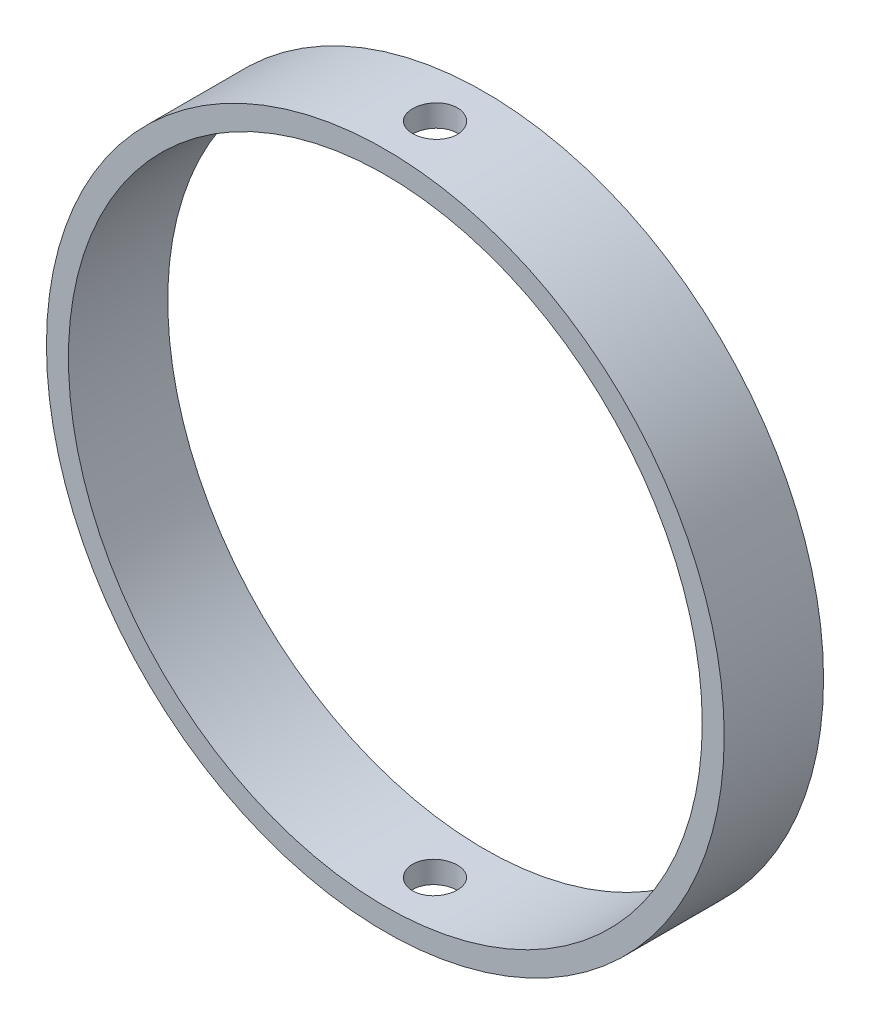
from build123d import *

# Parameters (mm, degrees)
SKETCH1_R           = 34.11
SKETCH1_R_2         = 31.9
BOSS_EXTRUDE1_DEPTH = 10
SKETCH2_R           = 2.25
CUT_EXTRUDE1_DEPTH  = 77.925031687


with BuildPart() as part:
    # Sketch1 → Boss-Extrude1 (new body)
    with BuildSketch(Plane.XY):
        Circle(SKETCH1_R)
        Circle(SKETCH1_R_2, mode=Mode.SUBTRACT)
    extrude(amount=BOSS_EXTRUDE1_DEPTH)

    # Sketch2 → Cut-Extrude1 (cut, through all)
    with BuildSketch(Plane(origin=(0, 34.11, 0), x_dir=(1, 0, 0), z_dir=(0, 1, 0))):
        with Locations((0, -5)):
            Circle(SKETCH2_R)
    extrude(amount=-CUT_EXTRUDE1_DEPTH, mode=Mode.SUBTRACT)


solid = part.part
